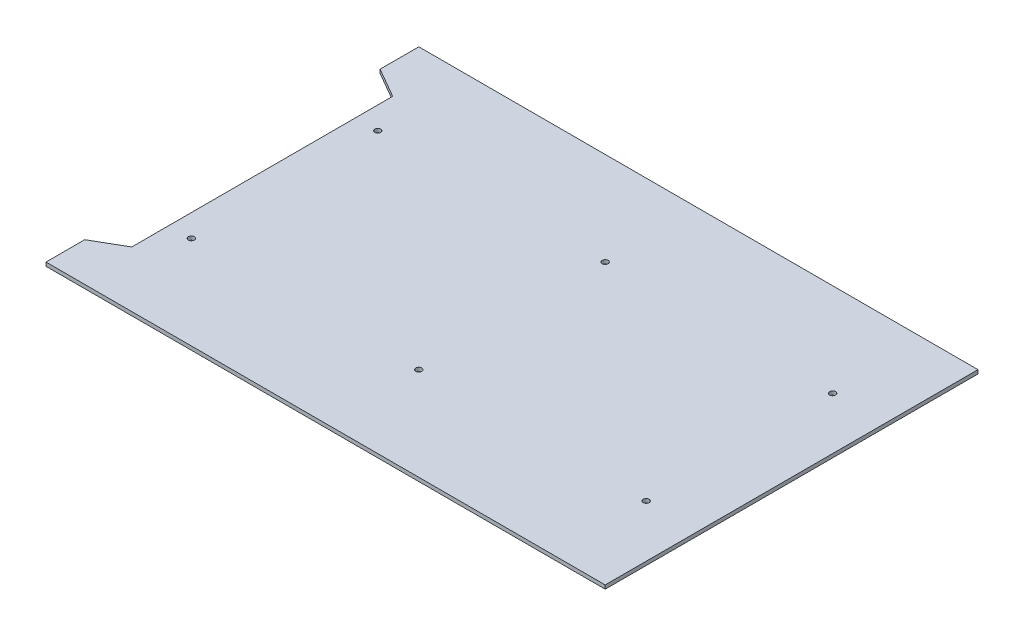
from build123d import *

# Parameters (mm, degrees)
SKETCH1_W           = 750
SKETCH1_H           = 500
BOSS_EXTRUDE1_DEPTH = 5
SKETCH2_R           = 4
CUT_EXTRUDE1_DEPTH  = 10
SKETCH3_R           = 4
CUT_EXTRUDE2_DEPTH  = 10
SKETCH4_R           = 4
CUT_EXTRUDE3_DEPTH  = 10
SKETCH5_R           = 4
CUT_EXTRUDE4_DEPTH  = 10
SKETCH6_R           = 4
CUT_EXTRUDE5_DEPTH  = 10
SKETCH7_R           = 4
CUT_EXTRUDE6_DEPTH  = 10
CUT_EXTRUDE7_REACH  = 452.722


with BuildPart() as part:
    # Sketch1 → Boss-Extrude1 (new body)
    with BuildSketch(Plane(origin=(0, 0, 0), x_dir=(1, 0, 0), z_dir=(0, 1, 0))):
        Rectangle(SKETCH1_W, SKETCH1_H)
    extrude(amount=BOSS_EXTRUDE1_DEPTH)

    # Sketch2 → Cut-Extrude1 (cut)
    with BuildSketch(Plane(origin=(0, 5, 0), x_dir=(1, 0, 0), z_dir=(0, 1, 0))):
        with Locations((305, 125)):
            Circle(SKETCH2_R)
    extrude(amount=-CUT_EXTRUDE1_DEPTH, mode=Mode.SUBTRACT)

    # Sketch3 → Cut-Extrude2 (cut)
    with BuildSketch(Plane(origin=(0, 5, 0), x_dir=(1, 0, 0), z_dir=(0, 1, 0))):
        with Locations((305, -125)):
            Circle(SKETCH3_R)
    extrude(amount=-CUT_EXTRUDE2_DEPTH, mode=Mode.SUBTRACT)

    # Sketch4 → Cut-Extrude3 (cut)
    with BuildSketch(Plane(origin=(0, 5, 0), x_dir=(1, 0, 0), z_dir=(0, 1, 0))):
        with Locations((0, 125)):
            Circle(SKETCH4_R)
    extrude(amount=-CUT_EXTRUDE3_DEPTH, mode=Mode.SUBTRACT)

    # Sketch5 → Cut-Extrude4 (cut)
    with BuildSketch(Plane(origin=(0, 5, 0), x_dir=(1, 0, 0), z_dir=(0, 1, 0))):
        with Locations((0, -125)):
            Circle(SKETCH5_R)
    extrude(amount=-CUT_EXTRUDE4_DEPTH, mode=Mode.SUBTRACT)

    # Sketch6 → Cut-Extrude5 (cut)
    with BuildSketch(Plane(origin=(0, 5, 0), x_dir=(1, 0, 0), z_dir=(0, 1, 0))):
        with Locations((-305, 125)):
            Circle(SKETCH6_R)
    extrude(amount=-CUT_EXTRUDE5_DEPTH, mode=Mode.SUBTRACT)

    # Sketch7 → Cut-Extrude6 (cut)
    with BuildSketch(Plane(origin=(0, 5, 0), x_dir=(1, 0, 0), z_dir=(0, 1, 0))):
        with Locations((-305, -125)):
            Circle(SKETCH7_R)
    extrude(amount=-CUT_EXTRUDE6_DEPTH, mode=Mode.SUBTRACT)

    # Sketch10 → Cut-Extrude7 (cut, up to next)
    with BuildSketch(Plane(origin=(0, 5, 0), x_dir=(1, 0, 0), z_dir=(0, 1, 0)), mode=Mode.PRIVATE) as cut_extrude7_sk1:
        Polygon((-335, 175), (-335, -175), (-375, -198.094010768), (-375, 198.094010768), align=None)
    cut_extrude7_tool1 = extrude(cut_extrude7_sk1.sketch, amount=-CUT_EXTRUDE7_REACH, mode=Mode.PRIVATE) & part.part
    add(cut_extrude7_tool1.solids().sort_by_distance((-355.412658, 5, 0))[0], mode=Mode.SUBTRACT)


solid = part.part
